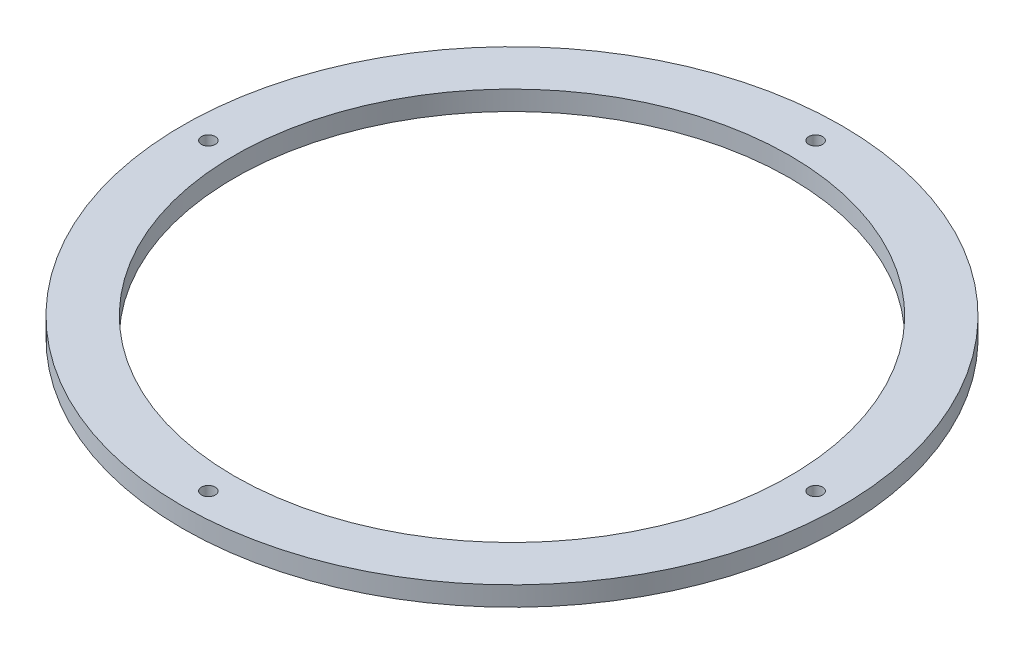
from build123d import *

# Parameters (mm, degrees)
SKETCH1_R               = 161.4
SKETCH1_R_2             = 136
BOSS_EXTRUDE1_DEPTH     = 9.525
F_1_4_CLEARANCE_HOLE1_D = 6.7564
CIRPATTERN1_COUNT       = 4


with BuildPart() as part:
    # Sketch1 → Boss-Extrude1 (new body)
    with BuildSketch(Plane(origin=(0, 0, 0), x_dir=(1, 0, 0), z_dir=(0, 1, 0))):
        Circle(SKETCH1_R)
        Circle(SKETCH1_R_2, mode=Mode.SUBTRACT)
    extrude(amount=BOSS_EXTRUDE1_DEPTH)

    # 1/4 Clearance Hole1 (through all)
    with Locations(Plane(origin=(0, 9.525, 0), x_dir=(1, 0, 0), z_dir=(0, 1, 0))):
        with Locations((0, -148.7)):
            f_1_4_clearance_hole1 = Hole(F_1_4_CLEARANCE_HOLE1_D / 2)

    # CirPattern1: 1/4 Clearance Hole1 ×4 about axis
    cirpattern1_axis = Axis((0, 9.525, 0), (0, -1, 0))
    for i in range(1, CIRPATTERN1_COUNT):
        add(f_1_4_clearance_hole1.rotate(cirpattern1_axis, i * 360 / CIRPATTERN1_COUNT), mode=Mode.SUBTRACT)


solid = part.part
